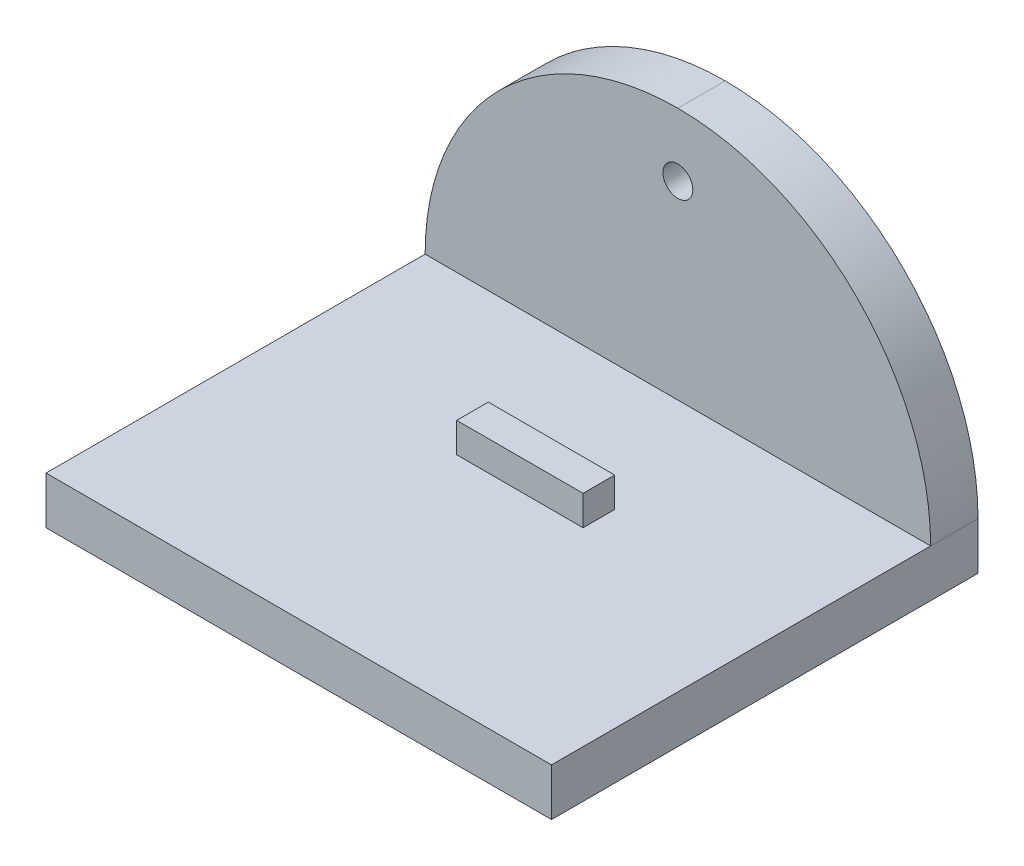
from build123d import *

# Parameters (mm, degrees)
BOSS_EXTRUDE1_DEPTH = 50.8
SKETCH2_W           = 12.7
SKETCH2_H           = 3.175
BOSS_EXTRUDE2_DEPTH = 2.9972
SKETCH3_R           = 1.499997
CUT_EXTRUDE1_DEPTH  = 71.299547696
FILLET1_R           = 25.4


with BuildPart() as part:
    # Sketch1 → Boss-Extrude1 (new body)
    with BuildSketch(Plane(origin=(0, 0, 0), x_dir=(0, 0, -1), z_dir=(1, 0, 0))):
        Polygon((0, 0), (-42.8625, 0), (-42.8625, 4.7625), (-4.7625, 4.7625), (-4.7625, 30.1625), (0, 30.1625), align=None)
    extrude(amount=BOSS_EXTRUDE1_DEPTH)

    # Sketch2 → Boss-Extrude2 (add)
    with BuildSketch(Plane(origin=(0, 4.7625, 0), x_dir=(1, 0, 0), z_dir=(0, 1, 0))):
        with Locations((25.4, -19.05)):
            Rectangle(SKETCH2_W, SKETCH2_H)
    extrude(amount=BOSS_EXTRUDE2_DEPTH)

    # Sketch3 → Cut-Extrude1 (cut, through all)
    with BuildSketch(Plane.XY.offset(4.7625)):
        with Locations((25.4, 23.8125)):
            Circle(SKETCH3_R)
    extrude(amount=-CUT_EXTRUDE1_DEPTH, mode=Mode.SUBTRACT)

    # Fillet1
    fillet1_edges = [part.edges().sort_by_distance(p)[0] for p in [
        (0, 30.1625, 2.38125),
        (50.8, 30.1625, 2.38125),
    ]]
    fillet(fillet1_edges, radius=FILLET1_R - 0.0001)  # a hair under: the kernel refuses the full size


solid = part.part
